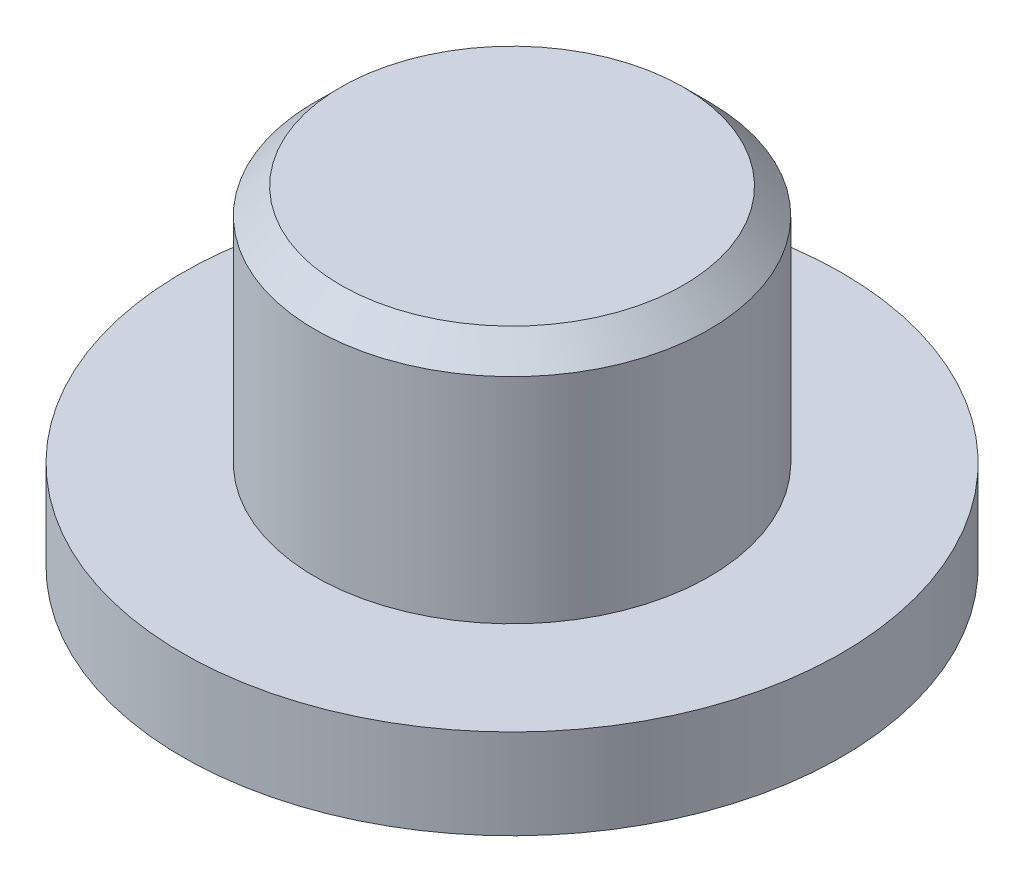
from build123d import *


# Read off the part's stored shape, not the designer's step: G1/4 Straight Pipe Tapped Thread Stud1
with BuildPart() as part:
    # Sketch1 → Revolve1 (revolve)
    with BuildSketch(Plane.XY, mode=Mode.PRIVATE) as revolve1_sk:
        Polygon((7, 0), (2, 0), (2, 3), (5.5, 8), (7, 8), align=None)
        Polygon((7, 0), (2, 0), (2, -3), (11, -3), (11, 0), align=None)
        Polygon((0, 8), (5.5, 8), (2, 3), (2, 0), (2, -3), (0, -3), align=None)
    revolve(revolve1_sk.sketch.rotate(Axis((0, 0, 0), (0, 1, 0)), 90), axis=Axis((0, 0, 0), (0, 1, 0)))

    # G1/4 Straight Pipe Tapped Thread Stud1 o → G1/4 Straight Pipe Tapped Thread Stud1 (revolve, cut)
    with BuildSketch(Plane.XY):
        Polygon((7, 8), (5.7225, 8), (6.5785, 7.144), (6.5785, 0), (7, 0), align=None)
    revolve(axis=Axis((0, 0, 0), (0, 1, 0)), mode=Mode.SUBTRACT)


solid = part.part
